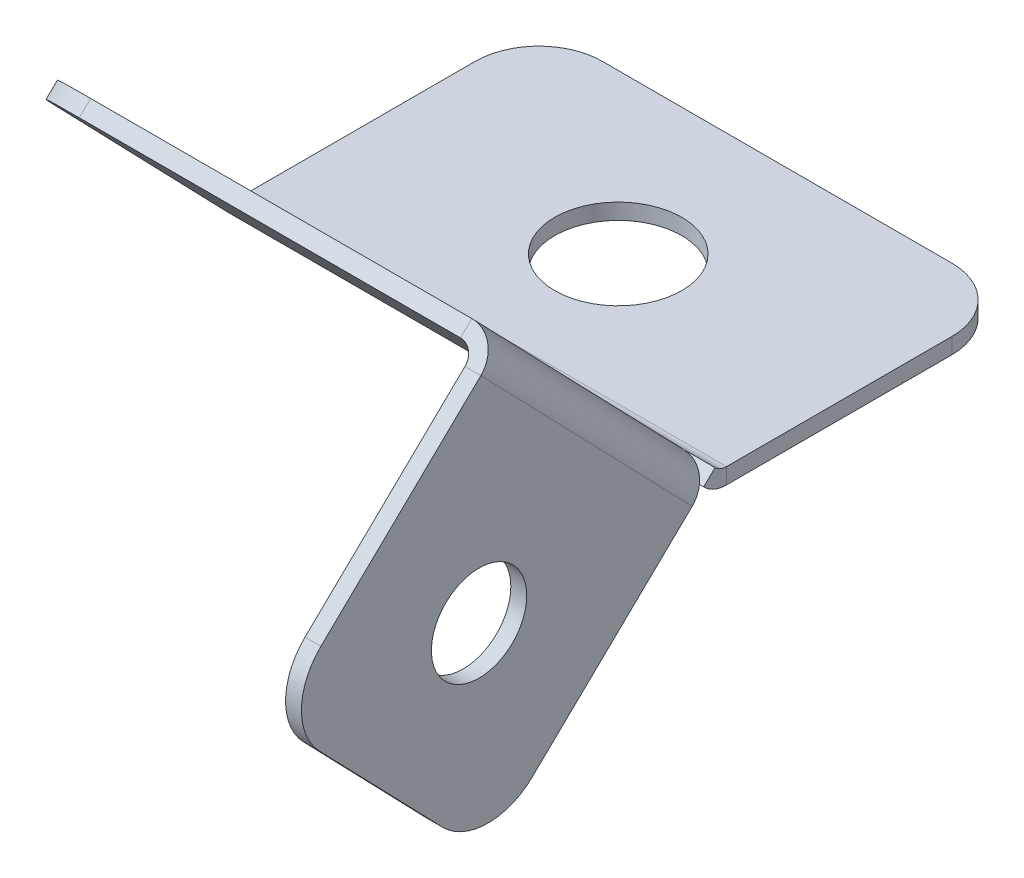
from build123d import *

# Parameters (mm, degrees)
SKETCH_1_W                       = 15
SKETCH_1_H                       = 10
SKETCH_1_R                       = 2
EXTRUDE_1_DEPTH                  = 0.5
SM_START                         = -7.5
SM_EDGE_FLANGE_1_DEPTH           = 15
SM_EDGE_FLANGE_1_2_DEPTH         = 15
SM_EDGE_FLANGE_2_STRIP_W         = 3
SM_EDGE_FLANGE_2_STRIP_H         = 0.5
SM_EDGE_FLANGE_2_STRIP_CUT_DEPTH = 9.575525184
SM_EDGE_FLANGE_2_DEPTH           = 9.575525184
SKETCH_12_R                      = 1.5
CUT_EXTRUDE_1_DEPTH              = 25.832637406
FILLET_1_R                       = 2


# Read off the part's stored shape, not the designer's step: Ребро-кромка1
# Sheet-metal steps are written as plain solids
with BuildPart() as part:
    # Sketch 1 → Бобышка-Вытянуть1 (new body)
    with BuildSketch(Plane(origin=(0, 0, 0), x_dir=(1, 0, 0), z_dir=(0, 1, 0))):
        Rectangle(SKETCH_1_W, SKETCH_1_H)
        with Locations(Location((0, 0, 0), (0, 0, 270))):
            Circle(SKETCH_1_R, mode=Mode.SUBTRACT)
    extrude(amount=EXTRUDE_1_DEPTH)

    # Ребро-кромка1 outline → Ребро-кромка1 (cut)
    with BuildSketch(Plane.YZ.offset(SM_START)):
        with BuildLine():
            ThreePointArc((0, 4.092680796), (0.079495147, 4.483411925), (0.30534163, 4.812020597))
            Line((0.30534163, 4.812020597), (0.5, 5))
            Line((0.5, 5), (0, 5))
            Line((0, 5), (0, 4.092680796))
        make_face()
    extrude(amount=SM_EDGE_FLANGE_1_DEPTH, mode=Mode.SUBTRACT)

    # Sm Edge Flange 1 2 outline → Sm Edge Flange 1 2 (add)
    with BuildSketch(Plane.YZ.offset(SM_START)):
        with BuildLine():
            Line((7.193398003, 11.463739317), (0.5, 5))
            Line((0.5, 5), (0.5, 4.092680796))
            ThreePointArc((0.5, 4.092680796), (0.539747573, 4.288046361), (0.652670815, 4.452350697))
            Line((0.652670815, 4.452350697), (7.540727189, 11.104069417))
            Line((7.540727189, 11.104069417), (7.193398003, 11.463739317))
        make_face()
    extrude(amount=SM_EDGE_FLANGE_1_2_DEPTH)

    # Ребро-кромка2 strip (across the edge) → Ребро-кромка2 strip cut (cut)
    with BuildSketch(Plane(origin=(7.5, 0.30534163, 4.812020597), x_dir=(-1, 0, 0), z_dir=(0, 0.7193398003386473, 0.6946583704590013))):
        with Locations((-0.5, -0.25)):
            Rectangle(SM_EDGE_FLANGE_2_STRIP_W, SM_EDGE_FLANGE_2_STRIP_H)
    extrude(amount=SM_EDGE_FLANGE_2_STRIP_CUT_DEPTH, mode=Mode.SUBTRACT)

    # Ребро-кромка2 section (across the edge) → Ребро-кромка2 (add)
    with BuildSketch(Plane(origin=(7.5, 0.30534163, 4.812020597), x_dir=(-1, 0, 0), z_dir=(0, 0.7193398003386473, 0.6946583704590013))):
        with BuildLine():
            Line((0, 0.5), (0, 9.5))
            Line((0, 9.5), (0.5, 9.5))
            Line((0.5, 9.5), (0.5, 0.5))
            ThreePointArc((0.5, 0.5), (0.646446609, 0.146446609), (1, 0))
            Line((1, 0), (1, -0.5))
            ThreePointArc((1, -0.5), (0.292893219, -0.207106781), (0, 0.5))
        make_face()
    extrude(amount=SM_EDGE_FLANGE_2_DEPTH)

    # Эскиз12 → Вырез-Вытянуть1 (cut, through all)
    with BuildSketch(Plane(origin=(7.5, 0, 0), x_dir=(0, 0, -1), z_dir=(1, 0, 0))):
        with Locations((-11.879995076, 0.128518841)):
            Circle(SKETCH_12_R)
    extrude(amount=-CUT_EXTRUDE_1_DEPTH, mode=Mode.SUBTRACT)

    # Скругление1
    fillet_1_edges = [part.edges().sort_by_distance(p)[0] for p in [
        (7.25, -6.29391289, 11.6457487),
        (7.25, 0.594143484, 18.29746742),
        (-7.5, 7.367062596, 11.283904367),
        (7.5, 0.25, -5),
        (-7.5, 0.25, -5),
    ]]
    fillet(fillet_1_edges, radius=FILLET_1_R)


solid = part.part
